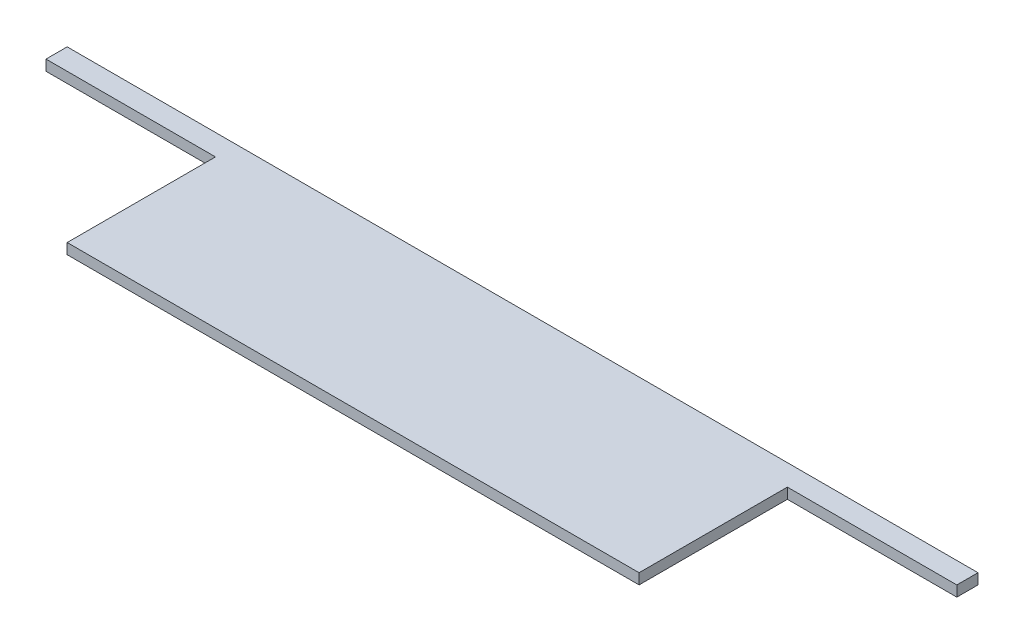
from build123d import *

# Parameters (mm, degrees)
BOSS_EXTRUDE1_DEPTH = 3.175


with BuildPart() as part:
    # Sketch1 → Boss-Extrude1 (new body)
    with BuildSketch(Plane(origin=(0, 0, 0), x_dir=(1, 0, 0), z_dir=(0, 1, 0))):
        Polygon((-136.525, 25.4), (-136.525, 19.05), (-85.725, 19.05), (-85.725, -25.4), (85.725, -25.4), (85.725, 19.05), (136.525, 19.05), (136.525, 25.4), align=None)
    extrude(amount=BOSS_EXTRUDE1_DEPTH)


solid = part.part
